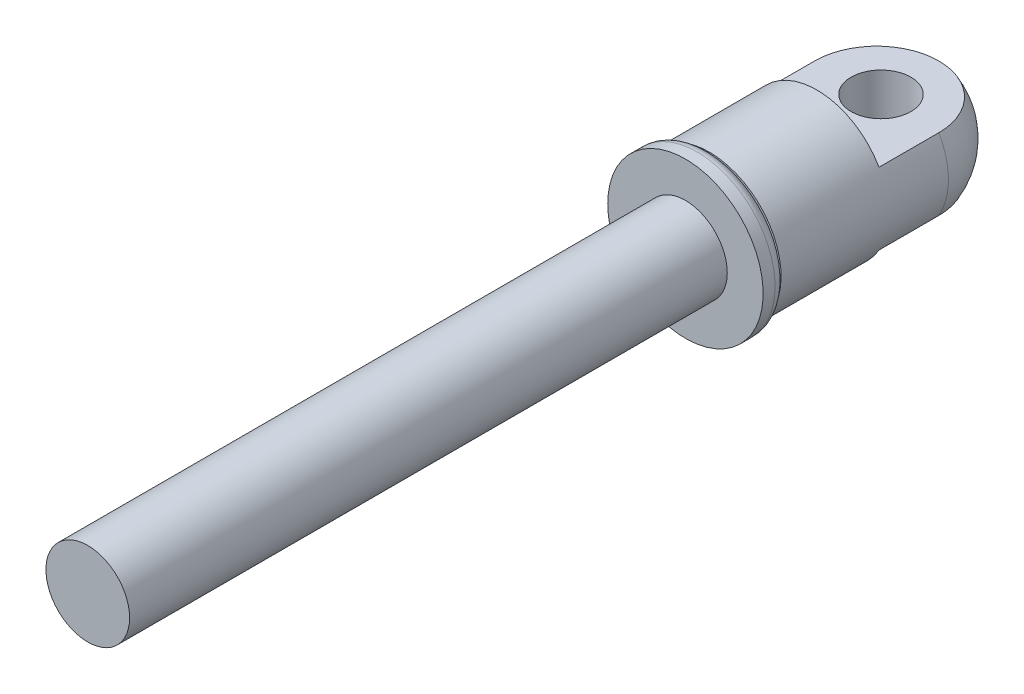
from build123d import *

# Parameters (mm, degrees)
ESQUISSE1_R             = 3.5
BOSS_EXTRU_1_DEPTH      = 50
ESQUISSE2_R             = 6.5
BOSS_EXTRU_2_DEPTH      = 2
CONG_1_R                = 1
ESQUISSE3_R             = 6
BOSS_EXTRU_3_DEPTH      = 20
ENL_V_START             = -11
ENL_V_MAT_EXTRU_1_DEPTH = 11
CONG_3_R                = 6
ESQUISSE5_R             = 2.5
ENL_V_MAT_EXTRU_2_DEPTH = 6


with BuildPart() as part:
    # Esquisse1 → Boss.-Extru.1 (new body)
    with BuildSketch(Plane.XY):
        Circle(ESQUISSE1_R)
    extrude(amount=BOSS_EXTRU_1_DEPTH)

    # Esquisse2 → Boss.-Extru.2 (add)
    with BuildSketch(Plane(origin=(0, 0, 0), x_dir=(-1, 0, 0), z_dir=(0, 0, -1))):
        Circle(ESQUISSE2_R)
    extrude(amount=BOSS_EXTRU_2_DEPTH)

    # Congé1
    cong_1_edges = [part.edges().sort_by_distance(p)[0] for p in [
        (6.5, 0, -2),
    ]]
    fillet(cong_1_edges, radius=CONG_1_R)

    # Esquisse3 → Boss.-Extru.3 (add)
    with BuildSketch(Plane(origin=(0, 0, -2), x_dir=(-1, 0, 0), z_dir=(0, 0, -1))):
        Circle(ESQUISSE3_R)
    extrude(amount=BOSS_EXTRU_3_DEPTH)

    # Esquisse4 → Enlèv. mat.-Extru.1 (cut)
    with BuildSketch(Plane(origin=(0, 0, -22), x_dir=(-1, 0, 0), z_dir=(0, 0, -1)).offset(ENL_V_START)):
        with BuildLine():
            Line((5.196152423, -3), (-5.196152423, -3))
            ThreePointArc((-5.196152423, -3), (0, -6), (5.196152423, -3))
        make_face()
        with BuildLine():
            ThreePointArc((5.196152423, 3), (0, 6), (-5.196152423, 3))
            Line((-5.196152423, 3), (5.196152423, 3))
        make_face()
    extrude(amount=ENL_V_MAT_EXTRU_1_DEPTH, mode=Mode.SUBTRACT)

    # Congé3
    # the kernel refuses this fillet: 6 mm, written as the material it takes off along each edge
    with BuildSketch(Plane(origin=(0, 0, -22), x_dir=(-0.9930943434085017, 0.11731847718938858, 0), z_dir=(-0.11731847718938858, -0.9930943434085017, 0))) as cong_3_piece_1:
        with BuildLine():
            CenterArc((0.0001, -5.9999), CONG_3_R, 0, 90)
            Line((0.0001, 0.0001), (0.0001, 0.1201))
            ThreePointArc((0.0001, 0.1201), (3.00005, 0.12), (6, 0.12))
            Line((6, 0.12), (6.12, 0))
            ThreePointArc((6.12, 0), (6.12, -2.99995), (6.1201, -5.9999))
            Line((6.1201, -5.9999), (6.0001, -5.9999))
        make_face()
    revolve(axis=Axis((0, 0, -22), (0, 0, -1)), revolution_arc=346.525261187, mode=Mode.SUBTRACT)
    with BuildSketch(Plane(origin=(0, 0, -22), x_dir=(-1, 0, 0), z_dir=(0, -1, 0))) as cong_3_piece_2:
        with BuildLine():
            CenterArc((0.0001, -5.9999), CONG_3_R, 0, 90)
            Line((0.0001, 0.0001), (0.0001, 0.1201))
            ThreePointArc((0.0001, 0.1201), (3.00005, 0.12), (6, 0.12))
            Line((6, 0.12), (6.12, 0))
            ThreePointArc((6.12, 0), (6.12, -2.99995), (6.1201, -5.9999))
            Line((6.1201, -5.9999), (6.0001, -5.9999))
        make_face()
    revolve(axis=Axis((0, 0, -22), (0, 0, -1)), revolution_arc=173.243453158, mode=Mode.SUBTRACT)
    with BuildSketch(Plane(origin=(0, 0, -22), x_dir=(0.9930550201853389, -0.11765086861003726, 0), z_dir=(0.11765086861003726, 0.9930550201853389, 0))) as cong_3_piece_3:
        with BuildLine():
            CenterArc((0.0001, -5.9999), CONG_3_R, 0, 90)
            Line((0.0001, 0.0001), (0.0001, 0.1201))
            ThreePointArc((0.0001, 0.1201), (3.00005, 0.12), (6, 0.12))
            Line((6, 0.12), (6.12, 0))
            ThreePointArc((6.12, 0), (6.12, -2.99995), (6.1201, -5.9999))
            Line((6.1201, -5.9999), (6.0001, -5.9999))
        make_face()
    revolve(axis=Axis((0, 0, -22), (0, 0, -1)), revolution_arc=173.243453158, mode=Mode.SUBTRACT)

    # Esquisse5 → Enlèv. mat.-Extru.2 (cut)
    with BuildSketch(Plane(origin=(0, 3, 0), x_dir=(1, 0, 0), z_dir=(0, 1, 0))):
        with Locations(Location((0, 16.359037674, 0), (0, 0, 180))):
            Circle(ESQUISSE5_R)
    extrude(amount=-ENL_V_MAT_EXTRU_2_DEPTH, mode=Mode.SUBTRACT)


solid = part.part
